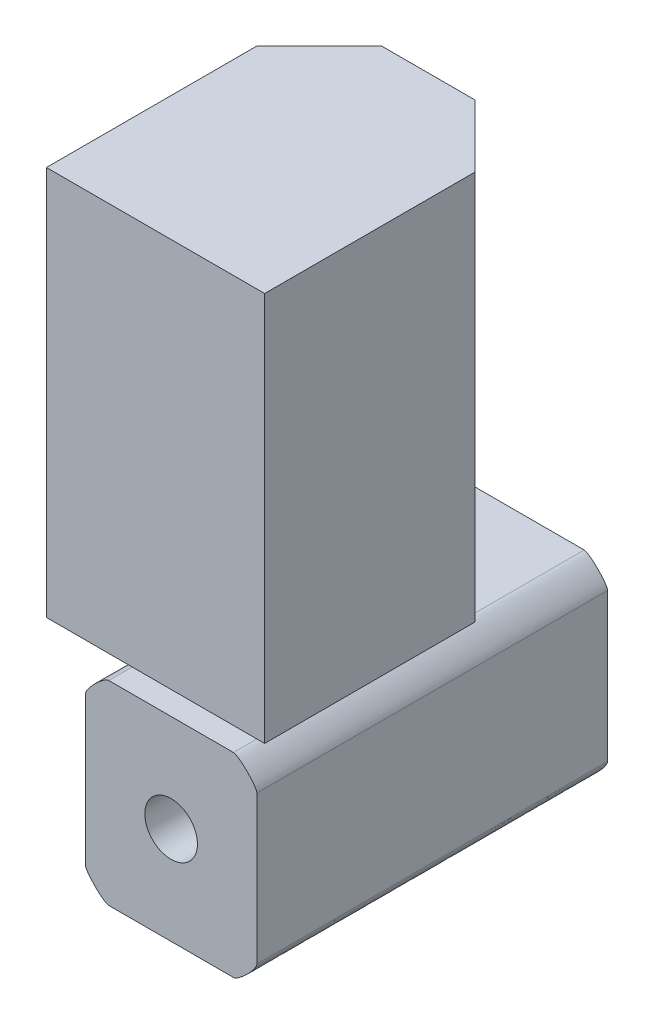
from build123d import *

# Parameters (mm, degrees)
ESQUISSE1_W                 = 22
ESQUISSE1_H                 = 25
BOSS_EXTRU_1_DEPTH          = 45
BOSS_EXTRU_2_DEPTH          = 5
BOSS_EXTRU_3_DEPTH          = 50
D_GAGEMENT_1_41_D           = 6.7564
D_GAGEMENT_1_41_CSINK_D     = 8.0264
D_GAGEMENT_1_41_CSINK_ANGLE = 90
CONG_1_SIZE                 = 3


with BuildPart() as part:
    # Esquisse1 → Boss.-Extru.1 (new body)
    with BuildSketch(Plane.XY):
        with Locations((-77.82148747, 16.657061647)):
            Rectangle(ESQUISSE1_W, ESQUISSE1_H)
    extrude(amount=BOSS_EXTRU_1_DEPTH)

    # Esquisse2 → Boss.-Extru.2 (add)
    with BuildSketch(Plane(origin=(0, 29.157061647, 0), x_dir=(1, 0, 0), z_dir=(0, 1, 0))):
        Polygon((-85.32148747, -18.169872981), (-85.32148747, -26.830127019), (-77.82148747, -31.160254038), (-70.32148747, -26.830127019), (-70.32148747, -18.169872981), (-77.82148747, -13.839745962), align=None)
    extrude(amount=BOSS_EXTRU_2_DEPTH)

    # Esquisse4 → Boss.-Extru.3 (add)
    # profile 1 of 2: a face of its own
    with BuildSketch(Plane(origin=(0, 34.157061647, 0), x_dir=(1, 0, 0), z_dir=(0, 1, 0))):
        Polygon((-71.82148747, -12), (-63.82148747, -20), (-63.82148747, -47), (-91.82148747, -47), (-91.82148747, -20), (-83.82148747, -12), align=None)
        Polygon((-77.82148747, -13.839745962), (-85.32148747, -18.169872981), (-85.32148747, -26.830127019), (-77.82148747, -31.160254038), (-70.32148747, -26.830127019), (-70.32148747, -18.169872981), align=None, mode=Mode.SUBTRACT)
    # profile 2 of 2: a face of its own
    with BuildSketch(Plane(origin=(0, 34.157061647, 0), x_dir=(1, 0, 0), z_dir=(0, 1, 0))):
        Polygon((-70.32148747, -18.169872981), (-77.82148747, -13.839745962), (-85.32148747, -18.169872981), (-85.32148747, -26.830127019), (-77.82148747, -31.160254038), (-70.32148747, -26.830127019), align=None)
    extrude(amount=BOSS_EXTRU_3_DEPTH)

    # Dégagement 1/41 (through all)
    with Locations(Plane(origin=(0, 0, 0), x_dir=(-1, 0, 0), z_dir=(0, 0, -1))):
        with Locations((77.82148747, 16.657061647)):
            CounterSinkHole(D_GAGEMENT_1_41_D / 2, D_GAGEMENT_1_41_CSINK_D / 2, counter_sink_angle=D_GAGEMENT_1_41_CSINK_ANGLE)

    # Congé1
    # a fillet whose section is not a circle: 3 mm, written as the material it takes off along each edge
    with BuildSketch(Plane(origin=(-88.82148747, 4.157061647, -7.5), x_dir=(1, 0, 0), z_dir=(0, 0, 1)), Plane(origin=(-66.82148747, 29.157061647, -7.5), x_dir=(-1, 0, 0), z_dir=(0, 0, 1)), Plane(origin=(-66.82148747, 4.157061647, -7.5), x_dir=(0, 1, 0), z_dir=(0, 0, 1))) as cong_1_piece_1:
        with BuildLine():
            Bezier((CONG_1_SIZE, 0), (0, 0), (0, CONG_1_SIZE), weights=[1, 0.212132034, 1])
            Line((0, CONG_1_SIZE), (0, 0))
            Line((0, 0), (CONG_1_SIZE, 0))
        make_face()
    extrude(amount=60, mode=Mode.SUBTRACT)
    with BuildSketch(Plane(origin=(-88.82148747, 29.157061647, -7.5), x_dir=(1, 0, 0), z_dir=(0, 0, 1))) as cong_1_piece_2:
        with BuildLine():
            Bezier((CONG_1_SIZE, 0), (0, 0), (0, -CONG_1_SIZE), weights=[1, 0.212132034, 1])
            Line((0, -CONG_1_SIZE), (0, 0))
            Line((0, 0), (CONG_1_SIZE, 0))
        make_face()
    extrude(amount=60, mode=Mode.SUBTRACT)


solid = part.part
